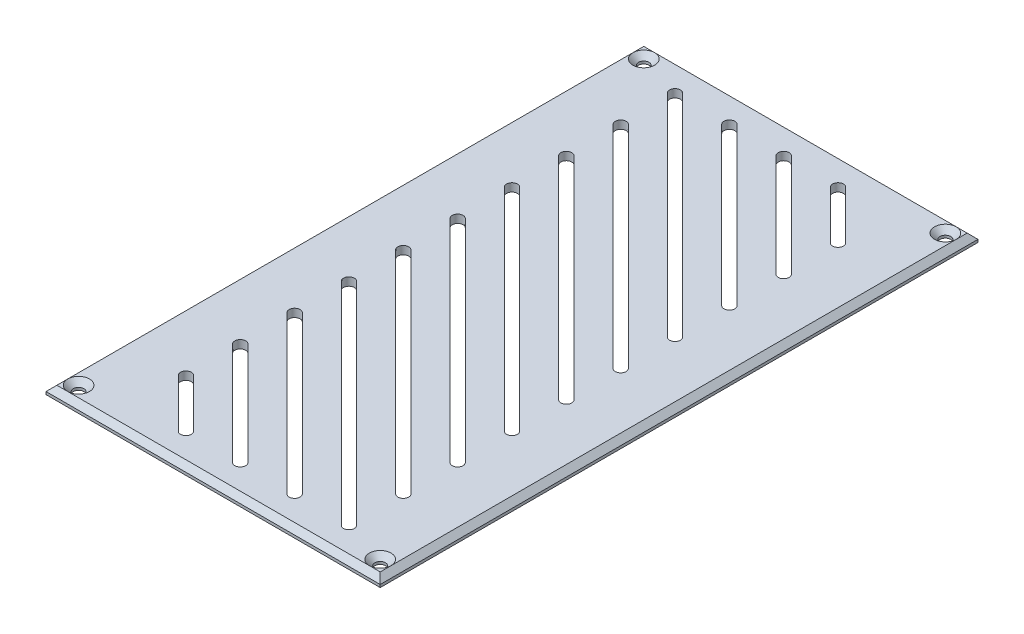
from build123d import *

# Parameters (mm, degrees)
SKETCH1_W           = 123
SKETCH1_H           = 220
BOSS_EXTRUDE1_DEPTH = 4
SKETCH2_W           = 123
SKETCH2_H           = 220
SKETCH2_W_2         = 115
SKETCH2_H_2         = 212
BOSS_EXTRUDE2_DEPTH = 87
CUT_EXTRUDE1_REACH  = 269.974
SKETCH3_W           = 115
SKETCH3_H           = 45
CUT_EXTRUDE2_REACH  = 269.974
SKETCH4_W           = 150
SKETCH4_H           = 20
SKETCH6_W           = 24
SKETCH6_H           = 37
SKETCH6_R           = 1.45
BOSS_EXTRUDE4_DEPTH = 3
SKETCH8_W           = 12
SKETCH8_H           = 12
BOSS_EXTRUDE5_DEPTH = 10
CUT_EXTRUDE3_REACH  = 269.974
SKETCH9_R           = 1.95
CUT_EXTRUDE4_REACH  = 269.974
SKETCH10_W          = 99
SKETCH10_H          = 40
CHAMFER1_SIZE       = 10
BOSS_EXTRUDE6_START = 3
SKETCH11_W          = 123
SKETCH11_H          = 220
SKETCH11_R          = 1.95
BOSS_EXTRUDE6_DEPTH = 3
CHAMFER2_SIZE       = 2.05
SKETCH12_W          = 123
SKETCH12_H          = 91
CUT_EXTRUDE5_DEPTH  = 270.007434841
CHAMFER3_SIZE       = 2
CUT_EXTRUDE6_DEPTH  = 253.06745129


with BuildPart() as part:
    # Sketch1 → Boss-Extrude1 (new body)
    with BuildSketch(Plane(origin=(0, 0, 0), x_dir=(1, 0, 0), z_dir=(0, 1, 0))):
        with Locations((61.5, 110)):
            Rectangle(SKETCH1_W, SKETCH1_H)
    extrude(amount=BOSS_EXTRUDE1_DEPTH)

    # Sketch2 → Boss-Extrude2 (add)
    with BuildSketch(Plane(origin=(0, 4, 0), x_dir=(1, 0, 0), z_dir=(0, 1, 0))):
        with Locations((61.5, 110)):
            Rectangle(SKETCH2_W, SKETCH2_H)
        with Locations((61.5, 110)):
            Rectangle(SKETCH2_W_2, SKETCH2_H_2, mode=Mode.SUBTRACT)
    extrude(amount=BOSS_EXTRUDE2_DEPTH)

    # Sketch3 → Cut-Extrude1 (cut, up to next)
    with BuildSketch(Plane.XY, mode=Mode.PRIVATE) as cut_extrude1_sk1:
        with Locations((61.5, 26.5)):
            Rectangle(SKETCH3_W, SKETCH3_H)
    cut_extrude1_tool1 = extrude(cut_extrude1_sk1.sketch, amount=-CUT_EXTRUDE1_REACH, mode=Mode.PRIVATE) & part.part
    add(cut_extrude1_tool1.solids().sort_by_distance((61.5, 26.5, 0))[0], mode=Mode.SUBTRACT)

    # Sketch4 → Cut-Extrude2 (cut, up to next)
    with BuildSketch(Plane(origin=(123, 0, 0), x_dir=(0, 0, -1), z_dir=(1, 0, 0)), mode=Mode.PRIVATE) as cut_extrude2_sk1:
        with Locations((125, 81)):
            Rectangle(SKETCH4_W, SKETCH4_H)
    cut_extrude2_tool1 = extrude(cut_extrude2_sk1.sketch, amount=-CUT_EXTRUDE2_REACH, mode=Mode.PRIVATE) & part.part
    add(cut_extrude2_tool1.solids().sort_by_distance((123, 81, -125))[0], mode=Mode.SUBTRACT)

    # Sketch6 → Boss-Extrude4 (add)
    # profile 1 of 2: a face of its own
    with BuildSketch(Plane(origin=(0, 49, 0), x_dir=(-1, 0, 0), z_dir=(0, -1, 0))):
        with Locations((-16, 22.5)):
            Rectangle(SKETCH6_W, SKETCH6_H)
        with Locations(Location((-25, 27.5, 0), (0, 0, 90))):
            Circle(SKETCH6_R, mode=Mode.SUBTRACT)
        with Locations(Location((-25, 17.5, 0), (0, 0, 270))):
            Circle(SKETCH6_R, mode=Mode.SUBTRACT)
    # profile 2 of 2: a face of its own
    with BuildSketch(Plane(origin=(0, 49, 0), x_dir=(-1, 0, 0), z_dir=(0, -1, 0))):
        with Locations((-107, 22.5)):
            Rectangle(SKETCH6_W, SKETCH6_H)
        with Locations(Location((-98, 17.5, 0), (0, 0, 90))):
            Circle(SKETCH6_R, mode=Mode.SUBTRACT)
        with Locations(Location((-98, 27.5, 0), (0, 0, 270))):
            Circle(SKETCH6_R, mode=Mode.SUBTRACT)
    extrude(amount=-BOSS_EXTRUDE4_DEPTH)

    # Sketch8 → Boss-Extrude5 (add)
    with BuildSketch(Plane(origin=(0, 91, 0), x_dir=(1, 0, 0), z_dir=(0, 1, 0))):
        with Locations((117, 214)):
            Rectangle(SKETCH8_W, SKETCH8_H)
        with Locations((6, 214)):
            Rectangle(SKETCH8_W, SKETCH8_H)
        with Locations((117, 6)):
            Rectangle(SKETCH8_W, SKETCH8_H)
        with Locations((6, 6)):
            Rectangle(SKETCH8_W, SKETCH8_H)
    extrude(amount=-BOSS_EXTRUDE5_DEPTH)

    # Sketch9 → Cut-Extrude3 (cut, up to next)
    with BuildSketch(Plane(origin=(0, 91, 0), x_dir=(1, 0, 0), z_dir=(0, 1, 0)), mode=Mode.PRIVATE) as cut_extrude3_sk1:
        with Locations(Location((6, 214, 0), (0, 0, 270))):
            Circle(SKETCH9_R)
    cut_extrude3_tool1 = extrude(cut_extrude3_sk1.sketch, amount=-CUT_EXTRUDE3_REACH, mode=Mode.PRIVATE) & part.part
    # Sketch9 → Cut-Extrude3 (cut, up to next)
    with BuildSketch(Plane(origin=(0, 91, 0), x_dir=(1, 0, 0), z_dir=(0, 1, 0)), mode=Mode.PRIVATE) as cut_extrude3_sk2:
        with Locations(Location((117, 214, 0), (0, 0, 90))):
            Circle(SKETCH9_R)
    cut_extrude3_tool2 = extrude(cut_extrude3_sk2.sketch, amount=-CUT_EXTRUDE3_REACH, mode=Mode.PRIVATE) & part.part
    # Sketch9 → Cut-Extrude3 (cut, up to next)
    with BuildSketch(Plane(origin=(0, 91, 0), x_dir=(1, 0, 0), z_dir=(0, 1, 0)), mode=Mode.PRIVATE) as cut_extrude3_sk3:
        with Locations(Location((117, 6, 0), (0, 0, 270))):
            Circle(SKETCH9_R)
    cut_extrude3_tool3 = extrude(cut_extrude3_sk3.sketch, amount=-CUT_EXTRUDE3_REACH, mode=Mode.PRIVATE) & part.part
    # Sketch9 → Cut-Extrude3 (cut, up to next)
    with BuildSketch(Plane(origin=(0, 91, 0), x_dir=(1, 0, 0), z_dir=(0, 1, 0)), mode=Mode.PRIVATE) as cut_extrude3_sk4:
        with Locations(Location((6, 6, 0), (0, 0, 90))):
            Circle(SKETCH9_R)
    cut_extrude3_tool4 = extrude(cut_extrude3_sk4.sketch, amount=-CUT_EXTRUDE3_REACH, mode=Mode.PRIVATE) & part.part
    add(cut_extrude3_tool1.solids().sort_by_distance((6, 91, -214))[0], mode=Mode.SUBTRACT)
    add(cut_extrude3_tool2.solids().sort_by_distance((117, 91, -214))[0], mode=Mode.SUBTRACT)
    add(cut_extrude3_tool3.solids().sort_by_distance((117, 91, -6))[0], mode=Mode.SUBTRACT)
    add(cut_extrude3_tool4.solids().sort_by_distance((6, 91, -6))[0], mode=Mode.SUBTRACT)

    # Sketch10 → Cut-Extrude4 (cut, up to next)
    with BuildSketch(Plane(origin=(0, 0, -220), x_dir=(-1, 0, 0), z_dir=(0, 0, -1)), mode=Mode.PRIVATE) as cut_extrude4_sk1:
        with Locations((-61.5, 71)):
            Rectangle(SKETCH10_W, SKETCH10_H)
    cut_extrude4_tool1 = extrude(cut_extrude4_sk1.sketch, amount=-CUT_EXTRUDE4_REACH, mode=Mode.PRIVATE) & part.part
    add(cut_extrude4_tool1.solids().sort_by_distance((61.5, 71, -220))[0], mode=Mode.SUBTRACT)

    # Chamfer1
    chamfer1_edges = [part.edges().sort_by_distance(p)[0] for p in [
        (4, 52, -22.5),
        (119, 52, -22.5),
    ]]
    chamfer(chamfer1_edges, length=CHAMFER1_SIZE)

    # Sketch11 → Boss-Extrude6 (add)
    with BuildSketch(Plane(origin=(0, 91, 0), x_dir=(1, 0, 0), z_dir=(0, 1, 0)).offset(BOSS_EXTRUDE6_START)):
        with Locations((61.5, 110)):
            Rectangle(SKETCH11_W, SKETCH11_H)
        with Locations(Location((6, 214, 0), (0, 0, 270))):
            Circle(SKETCH11_R, mode=Mode.SUBTRACT)
        with Locations(Location((117, 214, 0), (0, 0, 270))):
            Circle(SKETCH11_R, mode=Mode.SUBTRACT)
        with Locations(Location((117, 6, 0), (0, 0, 270))):
            Circle(SKETCH11_R, mode=Mode.SUBTRACT)
        with Locations(Location((6, 6, 0), (0, 0, 270))):
            Circle(SKETCH11_R, mode=Mode.SUBTRACT)
    extrude(amount=-BOSS_EXTRUDE6_DEPTH)

    # Chamfer2
    chamfer2_edges = [part.edges().sort_by_distance(p)[0] for p in [
        (6, 94, -215.95),
        (117, 94, -215.95),
        (117, 94, -7.95),
        (6, 94, -7.95),
    ]]
    chamfer(chamfer2_edges, length=CHAMFER2_SIZE)

    # Sketch12 → Cut-Extrude5 (cut, through all)
    with BuildSketch(Plane(origin=(0, 0, -220), x_dir=(-1, 0, 0), z_dir=(0, 0, -1))):
        with Locations((-61.5, 45.5)):
            Rectangle(SKETCH12_W, SKETCH12_H)
    extrude(amount=-CUT_EXTRUDE5_DEPTH, mode=Mode.SUBTRACT)

    # Chamfer3
    chamfer3_edges = [part.edges().sort_by_distance(p)[0] for p in [
        (0, 94, -110),
        (61.5, 94, 0),
        (123, 94, -110),
        (61.5, 94, -220),
    ]]
    chamfer(chamfer3_edges, length=CHAMFER3_SIZE - 0.0001)  # a hair under: the kernel refuses the full size

    # Sketch13 → Cut-Extrude6 (cut, through all)
    with BuildSketch(Plane(origin=(0, 94, 0), x_dir=(1, 0, 0), z_dir=(0, 1, 0))):
        with BuildLine():
            Line((24.023340597, 150.305086528), (101.805086528, 72.523340597))
            ThreePointArc((101.805086528, 72.523340597), (101.805086528, 69.694913472), (98.976659403, 69.694913472))
            Line((98.976659403, 69.694913472), (21.194913472, 147.476659403))
            ThreePointArc((21.194913472, 147.476659403), (21.194913472, 150.305086528), (24.023340597, 150.305086528))
        make_face()
        with BuildLine():
            Line((24.023340597, 30.305086528), (41.805086528, 12.523340597))
            ThreePointArc((41.805086528, 12.523340597), (41.805086528, 9.694913472), (38.976659403, 9.694913472))
            Line((38.976659403, 9.694913472), (21.194913472, 27.476659403))
            ThreePointArc((21.194913472, 27.476659403), (21.194913472, 30.305086528), (24.023340597, 30.305086528))
        make_face()
        with BuildLine():
            Line((24.023340597, 50.305086528), (61.805086528, 12.523340597))
            ThreePointArc((61.805086528, 12.523340597), (61.805086528, 9.694913472), (58.976659403, 9.694913472))
            Line((58.976659403, 9.694913472), (21.194913472, 47.476659403))
            ThreePointArc((21.194913472, 47.476659403), (21.194913472, 50.305086528), (24.023340597, 50.305086528))
        make_face()
        with BuildLine():
            Line((24.023340597, 70.305086528), (81.805086528, 12.523340597))
            ThreePointArc((81.805086528, 12.523340597), (81.805086528, 9.694913472), (78.976659403, 9.694913472))
            Line((78.976659403, 9.694913472), (21.194913472, 67.476659403))
            ThreePointArc((21.194913472, 67.476659403), (21.194913472, 70.305086528), (24.023340597, 70.305086528))
        make_face()
        with BuildLine():
            Line((24.023340597, 90.305086528), (101.805086528, 12.523340597))
            ThreePointArc((101.805086528, 12.523340597), (101.805086528, 9.694913472), (98.976659403, 9.694913472))
            Line((98.976659403, 9.694913472), (21.194913472, 87.476659403))
            ThreePointArc((21.194913472, 87.476659403), (21.194913472, 90.305086528), (24.023340597, 90.305086528))
        make_face()
        with BuildLine():
            Line((24.023340597, 110.305086528), (101.805086528, 32.523340597))
            ThreePointArc((101.805086528, 32.523340597), (101.805086528, 29.694913472), (98.976659403, 29.694913472))
            Line((98.976659403, 29.694913472), (21.194913472, 107.476659403))
            ThreePointArc((21.194913472, 107.476659403), (21.194913472, 110.305086528), (24.023340597, 110.305086528))
        make_face()
        with BuildLine():
            Line((44.023340597, 210.305086528), (101.805086528, 152.523340597))
            ThreePointArc((101.805086528, 152.523340597), (101.805086528, 149.694913472), (98.976659403, 149.694913472))
            Line((98.976659403, 149.694913472), (41.194913472, 207.476659403))
            ThreePointArc((41.194913472, 207.476659403), (41.194913472, 210.305086528), (44.023340597, 210.305086528))
        make_face()
        with BuildLine():
            Line((24.023340597, 130.305086528), (101.805086528, 52.523340597))
            ThreePointArc((101.805086528, 52.523340597), (101.805086528, 49.694913472), (98.976659403, 49.694913472))
            Line((98.976659403, 49.694913472), (21.194913472, 127.476659403))
            ThreePointArc((21.194913472, 127.476659403), (21.194913472, 130.305086528), (24.023340597, 130.305086528))
        make_face()
        with BuildLine():
            Line((64.023340597, 210.305086528), (101.805086528, 172.523340597))
            ThreePointArc((101.805086528, 172.523340597), (101.805086528, 169.694913472), (98.976659403, 169.694913472))
            Line((98.976659403, 169.694913472), (61.194913472, 207.476659403))
            ThreePointArc((61.194913472, 207.476659403), (61.194913472, 210.305086528), (64.023340597, 210.305086528))
        make_face()
        with BuildLine():
            Line((24.023340597, 210.305086528), (101.805086528, 132.523340597))
            ThreePointArc((101.805086528, 132.523340597), (101.805086528, 129.694913472), (98.976659403, 129.694913472))
            Line((98.976659403, 129.694913472), (21.194913472, 207.476659403))
            ThreePointArc((21.194913472, 207.476659403), (21.194913472, 210.305086528), (24.023340597, 210.305086528))
        make_face()
        with BuildLine():
            Line((24.023340597, 190.305086528), (101.805086528, 112.523340597))
            ThreePointArc((101.805086528, 112.523340597), (101.805086528, 109.694913472), (98.976659403, 109.694913472))
            Line((98.976659403, 109.694913472), (21.194913472, 187.476659403))
            ThreePointArc((21.194913472, 187.476659403), (21.194913472, 190.305086528), (24.023340597, 190.305086528))
        make_face()
        with BuildLine():
            Line((24.023340597, 170.305086528), (101.805086528, 92.523340597))
            ThreePointArc((101.805086528, 92.523340597), (101.805086528, 89.694913472), (98.976659403, 89.694913472))
            Line((98.976659403, 89.694913472), (21.194913472, 167.476659403))
            ThreePointArc((21.194913472, 167.476659403), (21.194913472, 170.305086528), (24.023340597, 170.305086528))
        make_face()
        with BuildLine():
            Line((84.023340597, 210.305086528), (101.805086528, 192.523340597))
            ThreePointArc((101.805086528, 192.523340597), (101.805086528, 189.694913472), (98.976659403, 189.694913472))
            Line((98.976659403, 189.694913472), (81.194913472, 207.476659403))
            ThreePointArc((81.194913472, 207.476659403), (81.194913472, 210.305086528), (84.023340597, 210.305086528))
        make_face()
    extrude(amount=-CUT_EXTRUDE6_DEPTH, mode=Mode.SUBTRACT)


solid = part.part
